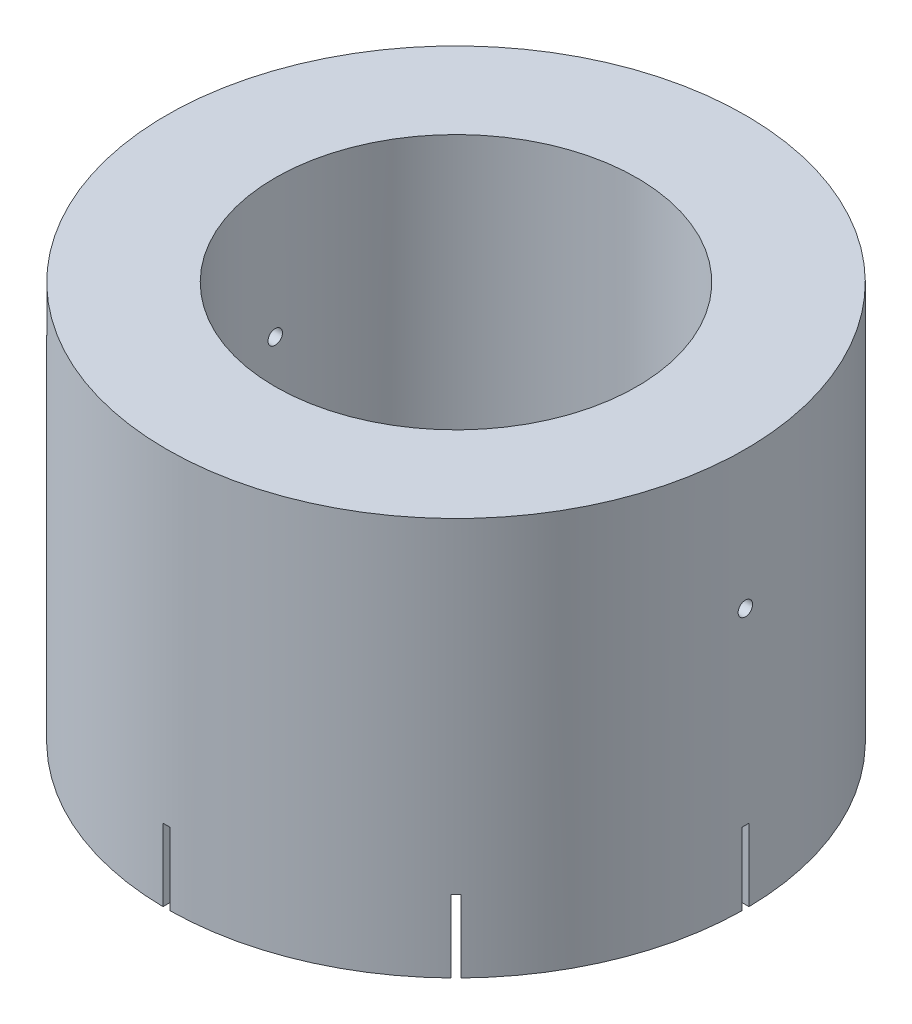
from build123d import *

# Parameters (mm, degrees)
SKETCH1_R               = 40
SKETCH1_R_2             = 25
BOSS_EXTRUDE1_DEPTH     = 50
BOSS_EXTRUDE2_START     = 5
SKETCH2_R               = 40
SKETCH2_R_2             = 37.5
BOSS_EXTRUDE2_DEPTH     = 5
CUT_EXTRUDE2_DEPTH      = 76.498344353
CUT_EXTRUDE2_DEPTH_BACK = 76.498344353
SKETCH3_R               = 1
SKETCH4_W               = 1
SKETCH4_H               = 10
CUT_EXTRUDE3_DEPTH      = 76.498344525
CIRPATTERN1_COUNT       = 4
CIRPATTERN1_ANGLE       = 135


with BuildPart() as part:
    # Sketch1 → Boss-Extrude1 (new body)
    with BuildSketch(Plane(origin=(0, 0, 0), x_dir=(1, 0, 0), z_dir=(0, 1, 0))):
        Circle(SKETCH1_R)
        Circle(SKETCH1_R_2, mode=Mode.SUBTRACT)
    extrude(amount=BOSS_EXTRUDE1_DEPTH)

    # Sketch2 → Boss-Extrude2 (add)
    with BuildSketch(Plane.XZ.offset(BOSS_EXTRUDE2_START)):
        Circle(SKETCH2_R)
        Circle(SKETCH2_R_2, mode=Mode.SUBTRACT)
    extrude(amount=-BOSS_EXTRUDE2_DEPTH)

    # Sketch3 → Cut-Extrude2 (cut, two sides: drawn at the far end of the back side and taken through both)
    with BuildSketch(Plane(origin=(0, 0, 0), x_dir=(0, 0, -1), z_dir=(1, 0, 0)).offset(-CUT_EXTRUDE2_DEPTH_BACK)):
        with Locations((0, 30.95)):
            Circle(SKETCH3_R)
    extrude(amount=CUT_EXTRUDE2_DEPTH + CUT_EXTRUDE2_DEPTH_BACK, mode=Mode.SUBTRACT)

    # Sketch4 → Cut-Extrude3 (cut, symmetric)
    with BuildSketch(Plane.XY):
        Rectangle(SKETCH4_W, SKETCH4_H)
    cut_extrude3 = extrude(amount=CUT_EXTRUDE3_DEPTH, both=True, mode=Mode.SUBTRACT)

    # CirPattern1: Cut-Extrude3 ×4 about axis
    cirpattern1_axis = Axis((0, 50, 0), (0, -1, 0))
    for i in range(1, CIRPATTERN1_COUNT):
        add(cut_extrude3.rotate(cirpattern1_axis, i * CIRPATTERN1_ANGLE / (CIRPATTERN1_COUNT - 1)), mode=Mode.SUBTRACT)


solid = part.part
